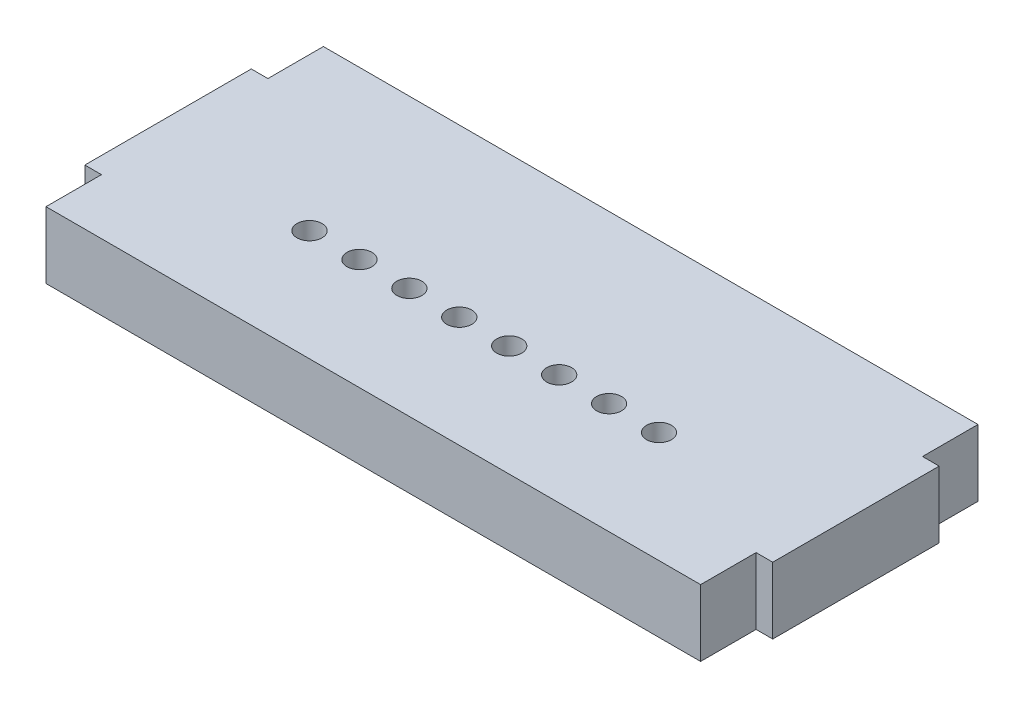
from build123d import *

# Parameters (mm, degrees)
IMPORTED_BODY_2_1_OUTLINE_R = 2.25
IMPORTED_BODY_2_1_DEPTH     = 12
SKETCH_2_W                  = 124
SKETCH_2_H                  = 100
CUT_EXTRUDE_1_DEPTH         = 12


# Read off the part's stored shape, not the designer's step: 基体零件-零件2-1
with BuildPart() as part:
    # 基体零件-零件2-1 outline → 基体零件-零件2-1 (new body)
    with BuildSketch(Plane(origin=(0, 0, 0), x_dir=(1, 0, 0), z_dir=(0, 1, 0))):
        Polygon((0, -150), (0, -140), (3, -140), (3, -110), (0, -110), (0, -90), (3, -90), (3, -60), (0, -60), (0, -40), (3, -40), (3, -10), (0, -10), (0, 0), (-118, 0), (-118, -10), (-121, -10), (-121, -40), (-118, -40), (-118, -60), (-121, -60), (-121, -90), (-118, -90), (-118, -110), (-121, -110), (-121, -140), (-118, -140), (-118, -150), align=None)
        with Locations((-90.5, -130)):
            Circle(IMPORTED_BODY_2_1_OUTLINE_R, mode=Mode.SUBTRACT)
        with Locations((-81.5, -130)):
            Circle(IMPORTED_BODY_2_1_OUTLINE_R, mode=Mode.SUBTRACT)
        with Locations((-72.5, -130)):
            Circle(IMPORTED_BODY_2_1_OUTLINE_R, mode=Mode.SUBTRACT)
        with Locations((-63.5, -130)):
            Circle(IMPORTED_BODY_2_1_OUTLINE_R, mode=Mode.SUBTRACT)
        with Locations((-54.5, -130)):
            Circle(IMPORTED_BODY_2_1_OUTLINE_R, mode=Mode.SUBTRACT)
        with Locations((-45.5, -130)):
            Circle(IMPORTED_BODY_2_1_OUTLINE_R, mode=Mode.SUBTRACT)
        with Locations((-36.5, -130)):
            Circle(IMPORTED_BODY_2_1_OUTLINE_R, mode=Mode.SUBTRACT)
        with Locations((-27.5, -130)):
            Circle(IMPORTED_BODY_2_1_OUTLINE_R, mode=Mode.SUBTRACT)
    extrude(amount=IMPORTED_BODY_2_1_DEPTH)

    # 草图2 → 切除-拉伸1 (cut)
    with BuildSketch(Plane(origin=(0, 12, 0), x_dir=(1, 0, 0), z_dir=(0, 1, 0))):
        with Locations((-59, -50)):
            Rectangle(SKETCH_2_W, SKETCH_2_H)
    extrude(amount=-CUT_EXTRUDE_1_DEPTH, mode=Mode.SUBTRACT)


solid = part.part
